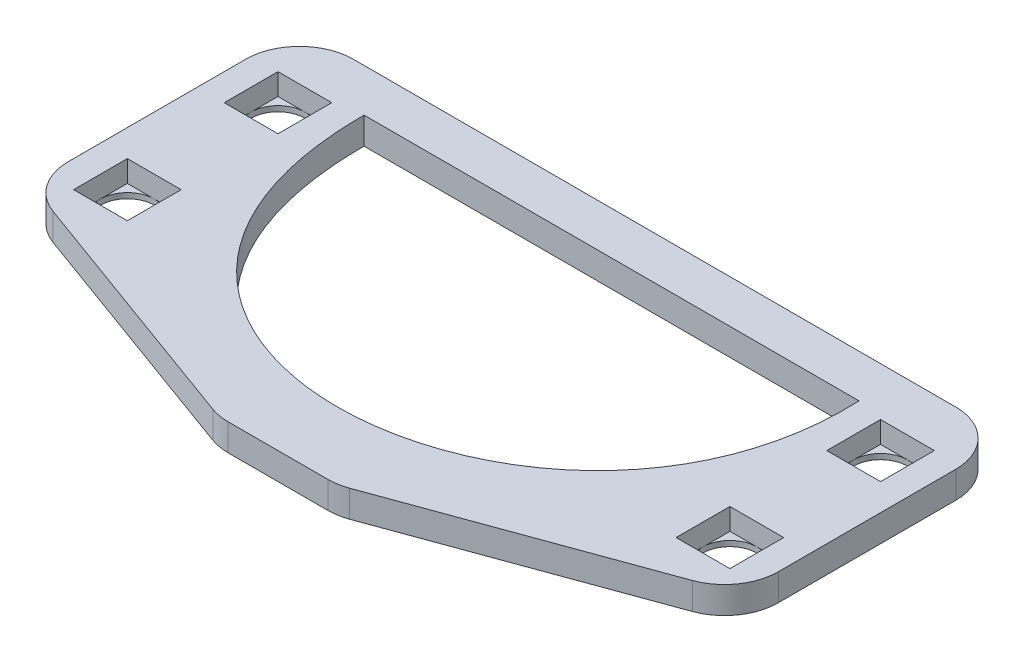
from build123d import *
from OCP.BRepFilletAPI import BRepFilletAPI_MakeChamfer

# Parameters (mm, degrees)
SKETCH1_W           = 66
SKETCH1_H           = 35
BOSS_EXTRUDE1_DEPTH = 2.5
SKETCH2_R           = 2.5
CUT_EXTRUDE1_DEPTH  = 75.74790967
CUT_EXTRUDE2_DEPTH  = 2
CHAMFER1_SIZE       = 10
CHAMFER1_SIZE2      = 27.474774195
FILLET1_R           = 5


with BuildPart() as part:
    # Sketch1 → Boss-Extrude1 (new body)
    with BuildSketch(Plane(origin=(0, 0, 0), x_dir=(1, 0, 0), z_dir=(0, 1, 0))):
        with Locations((33, 17.5)):
            Rectangle(SKETCH1_W, SKETCH1_H)
    extrude(amount=BOSS_EXTRUDE1_DEPTH)

    # Sketch2 → Cut-Extrude1 (cut, through all)
    with BuildSketch(Plane(origin=(0, 2.5, 0), x_dir=(1, 0, 0), z_dir=(0, 1, 0))):
        with BuildLine():
            Line((56, 31), (10, 31))
            add(Edge.make_bspline(
                [(56, 31), (57.291850068, 0.360049375), (9.956177665, -4.225689429), (10, 31)],
                knots=[0, 0, 0, 0, 1, 1, 1, 1], degree=3))
        make_face()
        with Locations((5, 28)):
            Circle(SKETCH2_R)
        with Locations((5, 14)):
            Circle(SKETCH2_R)
        with Locations((61, 14)):
            Circle(SKETCH2_R)
        with Locations((61, 28)):
            Circle(SKETCH2_R)
    extrude(amount=-CUT_EXTRUDE1_DEPTH, mode=Mode.SUBTRACT)

    # Sketch2<3> → Cut-Extrude2 (cut)
    with BuildSketch(Plane(origin=(0, 2.5, 0), x_dir=(1, 0, 0), z_dir=(0, 1, 0))):
        with BuildLine():
            Line((7.5, 28), (7.5, 30.5))
            Line((7.5, 30.5), (5, 30.5))
            ThreePointArc((5, 30.5), (6.767766953, 29.767766953), (7.5, 28))
        make_face()
        with BuildLine():
            ThreePointArc((2.5, 27.999999992), (3.232233044, 29.76776695), (5, 30.5))
            Line((5, 30.5), (2.5, 30.5))
            Line((2.5, 30.5), (2.5, 27.999999992))
        make_face()
        with BuildLine():
            Line((7.5, 25.5), (7.5, 28))
            ThreePointArc((7.5, 28), (6.767766953, 26.232233047), (5, 25.5))
            Line((5, 25.5), (7.5, 25.5))
        make_face()
        with BuildLine():
            ThreePointArc((5, 25.5), (3.23223305, 26.232233044), (2.5, 27.999999992))
            Line((2.5, 27.999999992), (2.5, 25.5))
            Line((2.5, 25.5), (5, 25.5))
        make_face()
        with BuildLine():
            Line((7.5, 14), (7.5, 16.5))
            Line((7.5, 16.5), (5, 16.5))
            ThreePointArc((5, 16.5), (6.767766953, 15.767766953), (7.5, 14))
        make_face()
        with BuildLine():
            ThreePointArc((2.5, 14), (3.232233047, 15.767766953), (5, 16.5))
            Line((5, 16.5), (2.5, 16.5))
            Line((2.5, 16.5), (2.5, 14))
        make_face()
        with BuildLine():
            Line((7.5, 11.5), (7.5, 14))
            ThreePointArc((7.5, 14), (6.767766953, 12.232233047), (5, 11.5))
            Line((5, 11.5), (7.5, 11.5))
        make_face()
        with BuildLine():
            ThreePointArc((5, 11.5), (3.232233047, 12.232233047), (2.5, 14))
            Line((2.5, 14), (2.5, 11.5))
            Line((2.5, 11.5), (5, 11.5))
        make_face()
        with BuildLine():
            Line((61, 16.5), (58.5, 16.5))
            Line((58.5, 16.5), (58.5, 14))
            ThreePointArc((58.5, 14), (59.232233047, 15.767766953), (61, 16.5))
        make_face()
        with BuildLine():
            Line((63.5, 16.5), (61, 16.5))
            ThreePointArc((61, 16.5), (62.767766953, 15.767766953), (63.5, 14))
            Line((63.5, 14), (63.5, 16.5))
        make_face()
        with BuildLine():
            ThreePointArc((61, 11.5), (59.232233047, 12.232233047), (58.5, 14))
            Line((58.5, 14), (58.5, 11.5))
            Line((58.5, 11.5), (61, 11.5))
        make_face()
        with BuildLine():
            Line((63.5, 11.5), (63.5, 14))
            ThreePointArc((63.5, 14), (62.767766953, 12.232233047), (61, 11.5))
            Line((61, 11.5), (63.5, 11.5))
        make_face()
        with BuildLine():
            Line((61, 30.5), (58.5, 30.5))
            Line((58.5, 30.5), (58.5, 28))
            ThreePointArc((58.5, 28), (59.232233047, 29.767766953), (61, 30.5))
        make_face()
        with BuildLine():
            Line((63.5, 30.5), (61, 30.5))
            ThreePointArc((61, 30.5), (62.767766953, 29.767766953), (63.5, 28))
            Line((63.5, 28), (63.5, 30.5))
        make_face()
        with BuildLine():
            ThreePointArc((61, 25.5), (59.232233047, 26.232233047), (58.5, 28))
            Line((58.5, 28), (58.5, 25.5))
            Line((58.5, 25.5), (61, 25.5))
        make_face()
        with BuildLine():
            Line((63.5, 25.5), (63.5, 28))
            ThreePointArc((63.5, 28), (62.767766953, 26.232233047), (61, 25.5))
            Line((61, 25.5), (63.5, 25.5))
        make_face()
    extrude(amount=-CUT_EXTRUDE2_DEPTH, mode=Mode.SUBTRACT)

    # Chamfer1: one chamfer whose edges measure the first distance from different faces: ONE call of the kernel's chamfer builder (chamfer() names one face for all edges)
    chamfer1_edges_1 = [part.edges().sort_by_distance(p)[0] for p in [
        (66, 1.25, 0),
    ]]
    chamfer1_side_1 = [part.faces().sort_by_distance(p)[0] for p in [
        (66, 1.25, -17.5),
    ]]
    chamfer1_edges_2 = [part.edges().sort_by_distance(p)[0] for p in [
        (0, 1.25, 0),
    ]]
    chamfer1_side_2 = [part.faces().sort_by_distance(p)[0] for p in [
        (0, 1.25, -17.5),
    ]]
    chamfer1 = BRepFilletAPI_MakeChamfer(part.part.solid().wrapped)
    for e in chamfer1_edges_1:
        chamfer1.Add(CHAMFER1_SIZE, CHAMFER1_SIZE2, e.wrapped, chamfer1_side_1[0].wrapped)  # the first distance lies on this face
    for e in chamfer1_edges_2:
        chamfer1.Add(CHAMFER1_SIZE, CHAMFER1_SIZE2, e.wrapped, chamfer1_side_2[0].wrapped)  # the first distance lies on this face
    add(Compound.cast(chamfer1.Shape()), mode=Mode.REPLACE)

    # Fillet1
    fillet1_edges = [part.edges().sort_by_distance(p)[0] for p in [
        (27.474774195, 1.25, 0),
        (38.525225805, 1.25, 0),
        (66, 1.25, -10),
        (66, 1.25, -35),
        (0, 1.25, -35),
        (0, 1.25, -10),
    ]]
    fillet(fillet1_edges, radius=FILLET1_R)


solid = part.part
